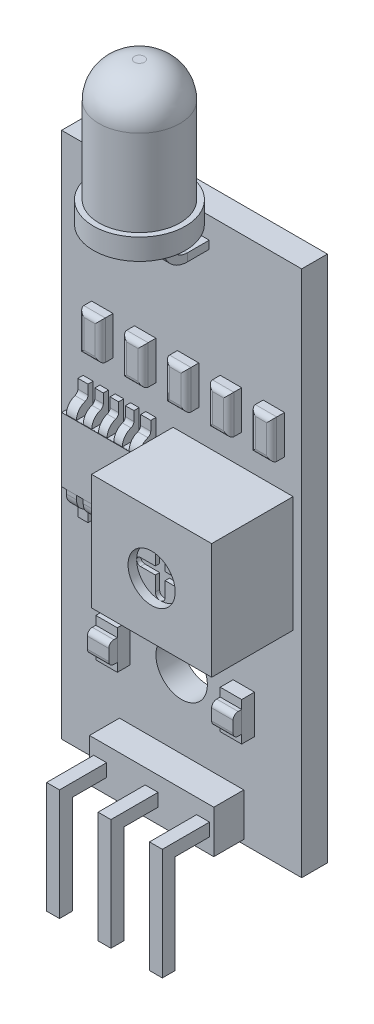
from build123d import *

# Parameters (mm, degrees)
SKETCH1_W               = 14.224
SKETCH1_H               = 31.242
BOSS_EXTRUDE1_DEPTH     = 0.762
SKETCH2_W               = 7.366
SKETCH2_H               = 2.54
BOSS_EXTRUDE2_DEPTH     = 1.778
BOSS_EXTRUDE3_START     = -4.318
SKETCH5_W               = 0.762
SKETCH5_H               = 0.762
BOSS_EXTRUDE3_DEPTH     = 6.35
SKETCH6_W               = 0.762
SKETCH6_H               = 0.762
BOSS_EXTRUDE4_DEPTH     = 6.604
LPATTERN1_COUNT         = 3
LPATTERN1_PITCH         = 3.048
CUT_EXTRUDE2_DEPTH      = 23.008773887
CUT_EXTRUDE2_DEPTH_BACK = 23.008773887
SKETCH8_R               = 1.524
SKETCH9_W               = 1.27
SKETCH9_H               = 2.286
BOSS_EXTRUDE5_DEPTH     = 0.762
SKETCH10_W              = 1.27
SKETCH10_H              = 1.27
BOSS_EXTRUDE6_DEPTH     = 0.508
LPATTERN2_START         = 3.048
LPATTERN2_OUTLINE_W     = 1.27
LPATTERN2_OUTLINE_H     = 0.508
LPATTERN2_DEPTH         = 1.27
LPATTERN2_START_2       = -9.779
LPATTERN2_2_OUTLINE_W   = 1.27
LPATTERN2_2_OUTLINE_H   = 0.762
LPATTERN2_2_DEPTH       = 2.286
SKETCH12_W              = 2.286
SKETCH12_H              = 1.27
BOSS_EXTRUDE7_DEPTH     = 0.762
LPATTERN3_COUNT         = 2
LPATTERN3_PITCH         = 5.842
SKETCH16_W              = 7.112
SKETCH16_H              = 6.858
BOSS_EXTRUDE9_DEPTH     = 4.826
SKETCH17_R              = 1.397
CUT_EXTRUDE3_DEPTH      = 0.508
CUT_EXTRUDE4_DEPTH      = 0.254
SKETCH19_W              = 1.27
SKETCH19_H              = 2.286
BOSS_EXTRUDE10_DEPTH    = 0.762
LPATTERN4_COUNT         = 5
LPATTERN4_PITCH         = 2.54
SKETCH31_W              = 4.826
SKETCH31_H              = 3.81
BOSS_EXTRUDE14_DEPTH    = 1.016
SKETCH32_W              = 4.318
SKETCH32_H              = 7.112
BOSS_EXTRUDE15_DEPTH    = 0.9906
SKETCH33_W              = 4.318
SKETCH33_H              = 0.762
CUT_EXTRUDE5_DEPTH      = 0.6858
FILLET4_R               = 0.762
FILLET5_R               = 0.254
CUT_EXTRUDE6_START      = -1.016
SKETCH38_W              = 0.4
SKETCH38_H              = 2.458537154
CUT_EXTRUDE6_DEPTH      = 0.9906
SKETCH39_W              = 0.47
SKETCH39_H              = 0.47
SKETCH41_R              = 2.725
BOSS_EXTRUDE16_DEPTH    = 1.25
SKETCH43_R              = 2.4
BOSS_EXTRUDE17_DEPTH    = 7.2
FILLET6_R               = 2.1
FILLET7_R               = 0.3
FILLET8_R               = 0.3
FILLET9_R               = 0.3


# Read off the part's stored shape, not the designer's step: LPattern2
with BuildPart() as part:
    # Sketch1 → Boss-Extrude1 (new, symmetric)
    with BuildSketch(Plane.XY):
        Rectangle(SKETCH1_W, SKETCH1_H)
    extrude(amount=BOSS_EXTRUDE1_DEPTH, both=True)

    # Sketch2 → Boss-Extrude2 (add)
    with BuildSketch(Plane.XY.offset(0.762)):
        with Locations((0, -14.097)):
            Rectangle(SKETCH2_W, SKETCH2_H)
    extrude(amount=BOSS_EXTRUDE2_DEPTH)

    # Sketch5 → Boss-Extrude3 (add)
    with BuildSketch(Plane.XY.offset(2.54).offset(BOSS_EXTRUDE3_START)):
        with Locations((-3.048, -14.097)):
            Rectangle(SKETCH5_W, SKETCH5_H)
    boss_extrude3 = extrude(amount=BOSS_EXTRUDE3_DEPTH)

    # Sketch6 → Boss-Extrude4 (add)
    with BuildSketch(Plane(origin=(0, -13.716, 0), x_dir=(1, 0, 0), z_dir=(0, 1, 0))):
        with Locations((-3.048, -4.953)):
            Rectangle(SKETCH6_W, SKETCH6_H)
    boss_extrude4 = extrude(amount=-BOSS_EXTRUDE4_DEPTH)

    # LPattern1: Boss-Extrude3, Boss-Extrude4 ×3
    with Locations(*[(i * LPATTERN1_PITCH, 0, 0) for i in range(1, LPATTERN1_COUNT)]):
        add(boss_extrude3)
        add(boss_extrude4)

    # Sketch8 → Cut-Extrude2 (cut, two sides: drawn at the far end of the back side and taken through both)
    with BuildSketch(Plane.XY.offset(0.762).offset(-CUT_EXTRUDE2_DEPTH_BACK)):
        with Locations(Location((0, -8.509, 0), (0, 0, 180))):
            Circle(SKETCH8_R)
    extrude(amount=CUT_EXTRUDE2_DEPTH + CUT_EXTRUDE2_DEPTH_BACK, mode=Mode.SUBTRACT)

    # Sketch9 → Boss-Extrude5 (add)
    with BuildSketch(Plane.XY.offset(0.762)):
        with Locations((-3.683, -8.636)):
            Rectangle(SKETCH9_W, SKETCH9_H)
    extrude(amount=BOSS_EXTRUDE5_DEPTH)

    # LPattern2 2 outline → LPattern2 2 (add)
    with BuildSketch(Plane(origin=(0, 0, 0), x_dir=(1, 0, 0), z_dir=(0, 1, 0)).offset(LPATTERN2_START_2)):
        with Locations((3.683, -1.143)):
            Rectangle(LPATTERN2_2_OUTLINE_W, LPATTERN2_2_OUTLINE_H)
    extrude(amount=LPATTERN2_2_DEPTH)

    # Sketch12 → Boss-Extrude7 (add)
    with BuildSketch(Plane.XY.offset(0.762)):
        with Locations((-2.921, -4.826)):
            Rectangle(SKETCH12_W, SKETCH12_H)
    boss_extrude7 = extrude(amount=BOSS_EXTRUDE7_DEPTH)

    # LPattern3: Boss-Extrude7 ×2
    with Locations(*[(i * LPATTERN3_PITCH, 0, 0) for i in range(1, LPATTERN3_COUNT)]):
        add(boss_extrude7)

    # Sketch16 → Boss-Extrude9 (add)
    with BuildSketch(Plane.XY.offset(0.762)):
        with Locations((3.048, 0.254)):
            Rectangle(SKETCH16_W, SKETCH16_H)
    extrude(amount=BOSS_EXTRUDE9_DEPTH)

    # Sketch17 → Cut-Extrude3 (cut)
    with BuildSketch(Plane.XY.offset(5.588)):
        with Locations((3.048, 0.127)):
            Circle(SKETCH17_R)
    extrude(amount=-CUT_EXTRUDE3_DEPTH, mode=Mode.SUBTRACT)

    # Sketch18 → Cut-Extrude4 (cut)
    with BuildSketch(Plane.XY.offset(5.08)):
        with BuildLine():
            Line((2.757000791, -0.979000791), (2.757000791, -0.102851416))
            Line((2.757000791, -0.102851416), (1.880851416, -0.102851416))
            ThreePointArc((1.880851416, -0.102851416), (1.651, 0.127), (1.880851416, 0.356851416))
            Line((1.880851416, 0.356851416), (2.757000791, 0.356851416))
            Line((2.757000791, 0.356851416), (2.757000791, 1.233000791))
            ThreePointArc((2.757000791, 1.233000791), (3.048, 1.524), (3.338999209, 1.233000791))
            Line((3.338999209, 1.233000791), (3.338999209, 0.356851416))
            Line((3.338999209, 0.356851416), (4.215148584, 0.356851416))
            ThreePointArc((4.215148584, 0.356851416), (4.445, 0.127), (4.215148584, -0.102851416))
            Line((4.215148584, -0.102851416), (3.338999209, -0.102851416))
            Line((3.338999209, -0.102851416), (3.338999209, -0.979000791))
            ThreePointArc((3.338999209, -0.979000791), (3.048, -1.27), (2.757000791, -0.979000791))
        make_face()
    extrude(amount=-CUT_EXTRUDE4_DEPTH, mode=Mode.SUBTRACT)

    # Sketch19 → Boss-Extrude10 (add)
    with BuildSketch(Plane.XY.offset(0.762)):
        with Locations((5.461, 6.604)):
            Rectangle(SKETCH19_W, SKETCH19_H)
    boss_extrude10 = extrude(amount=BOSS_EXTRUDE10_DEPTH)

    # LPattern4: Boss-Extrude10 ×5
    with Locations(*[(-i * LPATTERN4_PITCH, 0, 0) for i in range(1, LPATTERN4_COUNT)]):
        add(boss_extrude10)

    # Sketch31 → Boss-Extrude14 (add)
    with BuildSketch(Plane.XY.offset(0.762)):
        with Locations((-3.683, 0.254)):
            Rectangle(SKETCH31_W, SKETCH31_H)
    extrude(amount=BOSS_EXTRUDE14_DEPTH)

    # Sketch32 → Boss-Extrude15 (add)
    with BuildSketch(Plane.XY.offset(0.762)):
        with Locations((-3.683, 0.127)):
            Rectangle(SKETCH32_W, SKETCH32_H)
    extrude(amount=BOSS_EXTRUDE15_DEPTH)

    # Sketch33 → Cut-Extrude5 (cut)
    with BuildSketch(Plane.XY.offset(1.7526)):
        with Locations((-3.683, -3.048)):
            Rectangle(SKETCH33_W, SKETCH33_H)
        with Locations((-3.683, 3.302)):
            Rectangle(SKETCH33_W, SKETCH33_H)
    extrude(amount=-CUT_EXTRUDE5_DEPTH, mode=Mode.SUBTRACT)

    # Fillet4
    # the kernel refuses this fillet: 0.762 mm, written as the material it takes off along each edge
    with BuildSketch(Plane(origin=(0.371451068, 2.921, 1.7526), x_dir=(0, -1, 0), z_dir=(-1, 0, 0))) as fillet4_piece_1_section:
        with BuildLine():
            CenterArc((0.758180427, -0.762), FILLET4_R, 90, 84.260829523)
            Line((0, -0.6858), (0, 0))
            Line((0, 0), (0.758180427, 0))
        make_face()
    fillet4_piece_1 = extrude(amount=8.108902135, mode=Mode.PRIVATE)
    fillet4_piece_1 = split(fillet4_piece_1, bisect_by=Plane(origin=(-0.508, 2.675007043, 1.556844553), z_dir=(-1, 0, 0)), keep=Keep.TOP, mode=Mode.PRIVATE)
    add(fillet4_piece_1, mode=Mode.SUBTRACT)
    with BuildSketch(Plane(origin=(0.371451068, -2.667, 1.7526), x_dir=(0, 1, 0), z_dir=(-1, 0, 0))) as fillet4_piece_2_section:
        with BuildLine():
            CenterArc((0.758180427, 0.762), FILLET4_R, 185.739170477, 84.260829523)
            Line((0, 0.6858), (0, 0))
            Line((0, 0), (0.758180427, 0))
        make_face()
    fillet4_piece_2 = extrude(amount=8.108902135, mode=Mode.PRIVATE)
    fillet4_piece_2 = split(fillet4_piece_2, bisect_by=Plane(origin=(-0.508, -2.421007043, 1.556844553), z_dir=(-1, 0, 0)), keep=Keep.TOP, mode=Mode.PRIVATE)
    add(fillet4_piece_2, mode=Mode.SUBTRACT)

    # Fillet5
    fillet5_edges = [part.edges().sort_by_distance(p)[0] for p in [
        (-3.683, -2.667, 1.0668),
        (-3.683, 2.921, 1.0668),
    ]]
    fillet(fillet5_edges, radius=FILLET5_R)

    # Sketch38 → Cut-Extrude6 (cut)
    with BuildSketch(Plane.XY.offset(1.778).offset(CUT_EXTRUDE6_START)):
        with Locations((-5.042, 3.39208815)):
            Rectangle(SKETCH38_W, SKETCH38_H)
        with Locations((-2.324, -2.88408815)):
            Rectangle(SKETCH38_W, SKETCH38_H)
        with Locations((-4.136, 3.39208815)):
            Rectangle(SKETCH38_W, SKETCH38_H)
        with Locations((-3.23, 3.39208815)):
            Rectangle(SKETCH38_W, SKETCH38_H)
        with Locations((-2.324, 3.39208815)):
            Rectangle(SKETCH38_W, SKETCH38_H)
        with Locations((-3.23, -2.88408815)):
            Rectangle(SKETCH38_W, SKETCH38_H)
        with Locations((-4.136, -2.88408815)):
            Rectangle(SKETCH38_W, SKETCH38_H)
        with Locations((-5.042, -2.88408815)):
            Rectangle(SKETCH38_W, SKETCH38_H)
    extrude(amount=CUT_EXTRUDE6_DEPTH, mode=Mode.SUBTRACT)

    # Sweep1: sweep along a path in Sketch40
    with BuildLine(Plane.ZY.offset(7.112)) as sweep1_path:
        Line((0.762, 14.121), (2.062, 14.121))
        ThreePointArc((2.062, 14.121), (2.910528137, 14.472471863), (3.262, 15.321))
        Line((3.262, 15.321), (3.262, 15.621))
    # Sketch39 → Sweep1 (sweep)
    with BuildSketch(Plane.XY.offset(0.762)):
        with Locations((-1.4, 14.121)):
            Rectangle(SKETCH39_W, SKETCH39_H)
        with Locations((1.4, 14.121)):
            Rectangle(SKETCH39_W, SKETCH39_H)
    sweep(path=sweep1_path.line)

    # Sketch41 → Boss-Extrude16 (add)
    with BuildSketch(Plane(origin=(0, 15.621, 0), x_dir=(1, 0, 0), z_dir=(0, 1, 0))):
        with Locations(Location((0, -3.262, 0), (0, 0, 113.446617255))):
            Circle(SKETCH41_R)
    extrude(amount=BOSS_EXTRUDE16_DEPTH)

    # Sketch43 → Boss-Extrude17 (add)
    with BuildSketch(Plane(origin=(0, 16.871, 0), x_dir=(1, 0, 0), z_dir=(0, 1, 0))):
        with Locations(Location((0, -3.262, 0), (0, 0, 270))):
            Circle(SKETCH43_R)
    extrude(amount=BOSS_EXTRUDE17_DEPTH)

    # Fillet6
    fillet6_edges = [part.edges().sort_by_distance(p)[0] for p in [
        (0, 24.071, 0.862),
    ]]
    fillet(fillet6_edges, radius=FILLET6_R)

    # Fillet9
    fillet9_edges = [part.edges().sort_by_distance(p)[0] for p in [
        (6.096, 6.604, 1.524),
        (5.461, 7.747, 1.524),
        (4.826, 6.604, 1.524),
        (5.461, 5.461, 1.524),
        (3.556, 6.604, 1.524),
        (2.921, 7.747, 1.524),
        (2.286, 6.604, 1.524),
        (2.921, 5.461, 1.524),
        (1.016, 6.604, 1.524),
        (0.381, 7.747, 1.524),
        (-0.254, 6.604, 1.524),
        (0.381, 5.461, 1.524),
        (-1.524, 6.604, 1.524),
        (-2.159, 7.747, 1.524),
        (-2.794, 6.604, 1.524),
        (-2.159, 5.461, 1.524),
        (-4.064, 6.604, 1.524),
        (-4.699, 7.747, 1.524),
        (-5.334, 6.604, 1.524),
        (-4.699, 5.461, 1.524),
    ]]
    fillet(fillet9_edges, radius=FILLET9_R)


with BuildPart() as body_2:
    # Sketch10 → Boss-Extrude6 (new body)
    with BuildSketch(Plane.XY.offset(1.524)):
        with Locations((-3.683, -8.636)):
            Rectangle(SKETCH10_W, SKETCH10_H)
    extrude(amount=BOSS_EXTRUDE6_DEPTH)

    # Fillet8
    fillet8_edges = [body_2.edges().sort_by_distance(p)[0] for p in [
        (-3.683, -8.001, 2.032),
        (-3.683, -9.271, 2.032),
    ]]
    fillet(fillet8_edges, radius=FILLET8_R)


with BuildPart() as body_3:
    # LPattern2 outline → LPattern2 (new body)
    with BuildSketch(Plane.YZ.offset(LPATTERN2_START)):
        with Locations((-8.636, 1.778)):
            Rectangle(LPATTERN2_OUTLINE_W, LPATTERN2_OUTLINE_H)
    extrude(amount=LPATTERN2_DEPTH)

    # Fillet7
    fillet7_edges = [body_3.edges().sort_by_distance(p)[0] for p in [
        (3.683, -8.001, 2.032),
        (3.683, -9.271, 2.032),
    ]]
    fillet(fillet7_edges, radius=FILLET7_R)


solid = Compound([part.part, body_2.part, body_3.part])
